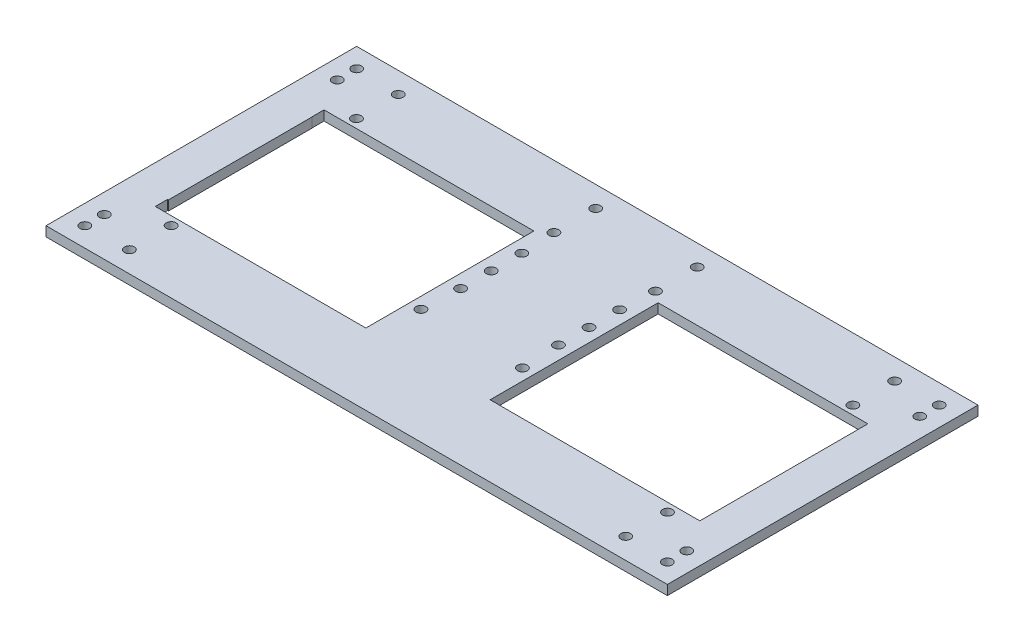
from build123d import *

# Parameters (mm, degrees)
SKETCH1_W           = 203.2
SKETCH1_H           = 101.6
SKETCH1_R           = 1.6
SKETCH1_W_2         = 68.58
SKETCH1_H_2         = 54.953705786
BOSS_EXTRUDE1_DEPTH = 3.175
SKETCH2_R           = 1.6
CUT_EXTRUDE1_DEPTH  = 10


with BuildPart() as part:
    # Sketch1 → Boss-Extrude1 (new body)
    with BuildSketch(Plane(origin=(0, 0, 0), x_dir=(1, 0, 0), z_dir=(0, 1, 0))):
        with Locations((101.6, -50.8)):
            Rectangle(SKETCH1_W, SKETCH1_H)
        Polygon((12.648382796, -23.323147107), (81.28, -23.323147107), (81.28, -78.276852893), (12.405089541, -78.276852893), (12.405089541, -74.276852893), (12.7, -74.276852893), (12.7, -27.323147107), (12.648382796, -27.323147107), align=None, mode=Mode.SUBTRACT)
        with Locations((20.431013284, -6.830786777)):
            Circle(SKETCH1_R, mode=Mode.SUBTRACT)
        with Locations((20.431013284, -20.49236033)):
            Circle(SKETCH1_R, mode=Mode.SUBTRACT)
        with Locations((85.6, -51.6)):
            Circle(SKETCH1_R, mode=Mode.SUBTRACT)
        with Locations((85.6, -41.6)):
            Circle(SKETCH1_R, mode=Mode.SUBTRACT)
        with Locations((85.6, -31.6)):
            Circle(SKETCH1_R, mode=Mode.SUBTRACT)
        with Locations((85, -20.49236033)):
            Circle(SKETCH1_R, mode=Mode.SUBTRACT)
        with Locations((85, -6.830786777)):
            Circle(SKETCH1_R, mode=Mode.SUBTRACT)
        with Locations((20.431013284, -94.769213223)):
            Circle(SKETCH1_R, mode=Mode.SUBTRACT)
        with Locations((20.431013284, -81.10763967)):
            Circle(SKETCH1_R, mode=Mode.SUBTRACT)
        with Locations((156.21, -50.8)):
            Rectangle(SKETCH1_W_2, SKETCH1_H_2, mode=Mode.SUBTRACT)
        with Locations((117.6, -51.6)):
            Circle(SKETCH1_R, mode=Mode.SUBTRACT)
        with Locations((117.6, -41.6)):
            Circle(SKETCH1_R, mode=Mode.SUBTRACT)
        with Locations((117.6, -31.6)):
            Circle(SKETCH1_R, mode=Mode.SUBTRACT)
        with Locations((118.2, -20.49236033)):
            Circle(SKETCH1_R, mode=Mode.SUBTRACT)
        with Locations((118.2, -6.830786777)):
            Circle(SKETCH1_R, mode=Mode.SUBTRACT)
        with Locations((85, -63.98136033)):
            Circle(SKETCH1_R, mode=Mode.SUBTRACT)
        with Locations((182.768986716, -20.49236033)):
            Circle(SKETCH1_R, mode=Mode.SUBTRACT)
        with Locations((182.768986716, -6.830786777)):
            Circle(SKETCH1_R, mode=Mode.SUBTRACT)
        with Locations((118.2, -63.98136033)):
            Circle(SKETCH1_R, mode=Mode.SUBTRACT)
        with Locations((182.768986716, -81.10763967)):
            Circle(SKETCH1_R, mode=Mode.SUBTRACT)
        with Locations((182.768986716, -94.769213223)):
            Circle(SKETCH1_R, mode=Mode.SUBTRACT)
    extrude(amount=-BOSS_EXTRUDE1_DEPTH)

    # Sketch2 → Cut-Extrude1 (cut)
    with BuildSketch(Plane.XZ.offset(3.175)):
        with Locations((6.35, 12.7)):
            Circle(SKETCH2_R)
        with Locations((6.35, 95.25)):
            Circle(SKETCH2_R)
        with Locations((6.35, 88.9)):
            Circle(SKETCH2_R)
        with Locations((196.85, 6.35)):
            Circle(SKETCH2_R)
        with Locations((196.85, 12.7)):
            Circle(SKETCH2_R)
        with Locations((196.85, 88.9)):
            Circle(SKETCH2_R)
        with Locations((6.35, 6.35)):
            Circle(SKETCH2_R)
        with Locations((196.85, 95.25)):
            Circle(SKETCH2_R)
    extrude(amount=-CUT_EXTRUDE1_DEPTH, mode=Mode.SUBTRACT)


solid = part.part
